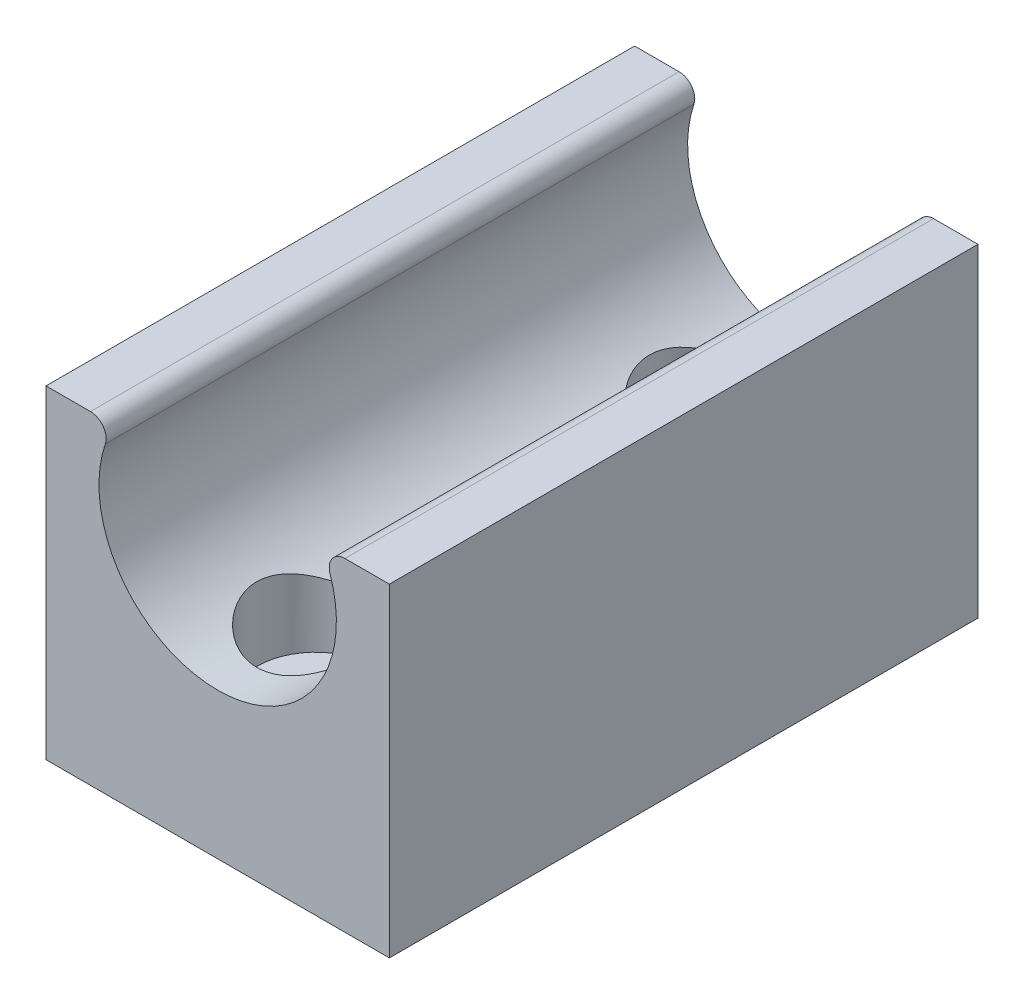
from build123d import *

# Parameters (mm, degrees)
BOSS_EXTRUDE1_DEPTH = 30
FILLET1_R           = 0.8
SKETCH3_R           = 3
CUT_EXTRUDE1_DEPTH  = 12
SKETCH4_R           = 1.55
CUT_EXTRUDE2_DEPTH  = 36.338541368


with BuildPart() as part:
    # Sketch1 → Boss-Extrude1 (new body)
    with BuildSketch(Plane.XY):
        with BuildLine():
            Line((-5.25, 8.25), (-8.75, 8.25))
            Line((-8.75, 8.25), (-8.75, -8.25))
            Line((-8.75, -8.25), (8.75, -8.25))
            Line((8.75, -8.25), (8.75, 8.25))
            Line((8.75, 8.25), (5.25, 8.25))
            ThreePointArc((5.25, 8.25), (0, -0.806659276), (-5.25, 8.25))
        make_face()
    extrude(amount=BOSS_EXTRUDE1_DEPTH)

    # Fillet1
    fillet1_edges = [part.edges().sort_by_distance(p)[0] for p in [
        (5.25, 8.25, 15),
        (-5.25, 8.25, 15),
    ]]
    fillet(fillet1_edges, radius=FILLET1_R)

    # Sketch3 → Cut-Extrude1 (cut)
    with BuildSketch(Plane(origin=(0, 8.25, 0), x_dir=(1, 0, 0), z_dir=(0, 1, 0))):
        with Locations((0, -5)):
            Circle(SKETCH3_R)
        with Locations((0, -25)):
            Circle(SKETCH3_R)
    extrude(amount=-CUT_EXTRUDE1_DEPTH, mode=Mode.SUBTRACT)

    # Sketch4 → Cut-Extrude2 (cut, through all)
    with BuildSketch(Plane(origin=(0, 8.25, 0), x_dir=(1, 0, 0), z_dir=(0, 1, 0))):
        with Locations((0, -5)):
            Circle(SKETCH4_R)
        with Locations((0, -25)):
            Circle(SKETCH4_R)
    extrude(amount=-CUT_EXTRUDE2_DEPTH, mode=Mode.SUBTRACT)


solid = part.part
